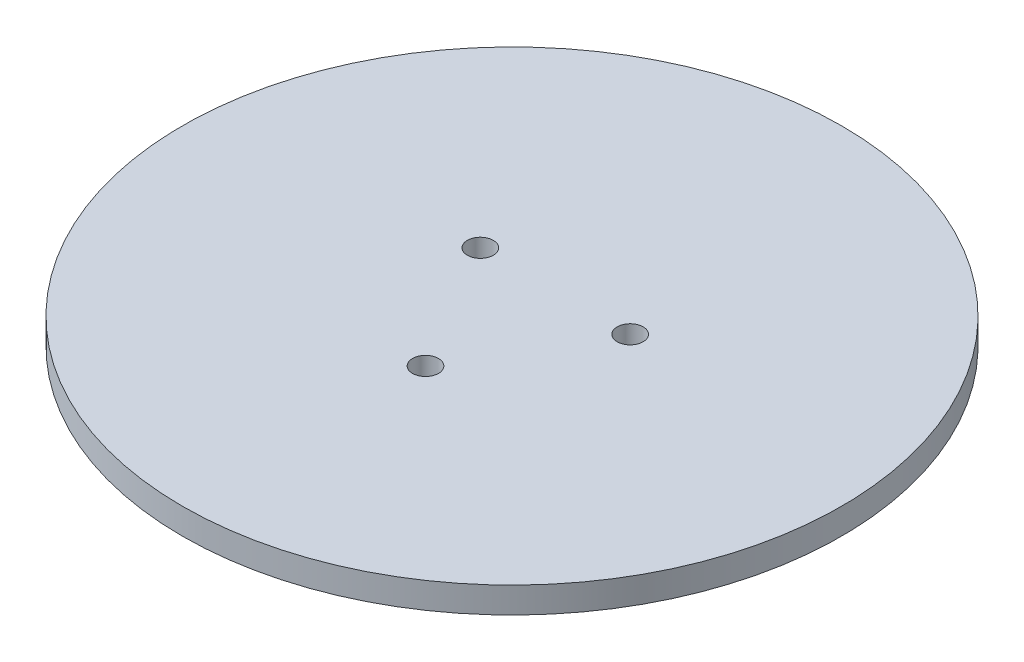
from build123d import *

# Parameters (mm, degrees)
SKETCH1_R           = 38.1
BOSS_EXTRUDE1_DEPTH = 3
SKETCH3_R           = 1.5
CUT_EXTRUDE2_DEPTH  = 54.96498865


with BuildPart() as part:
    # Sketch1 → Boss-Extrude1 (new body)
    with BuildSketch(Plane(origin=(0, 0, 0), x_dir=(1, 0, 0), z_dir=(0, 1, 0))):
        Circle(SKETCH1_R)
    extrude(amount=BOSS_EXTRUDE1_DEPTH)

    # Sketch3 → Cut-Extrude2 (cut, through all)
    with BuildSketch(Plane(origin=(0, 3, 0), x_dir=(1, 0, 0), z_dir=(0, 1, 0))):
        with Locations((-8.660254038, 5)):
            Circle(SKETCH3_R)
        with Locations((8.660254038, 5)):
            Circle(SKETCH3_R)
        with Locations((0, -10)):
            Circle(SKETCH3_R)
    extrude(amount=-CUT_EXTRUDE2_DEPTH, mode=Mode.SUBTRACT)


solid = part.part
